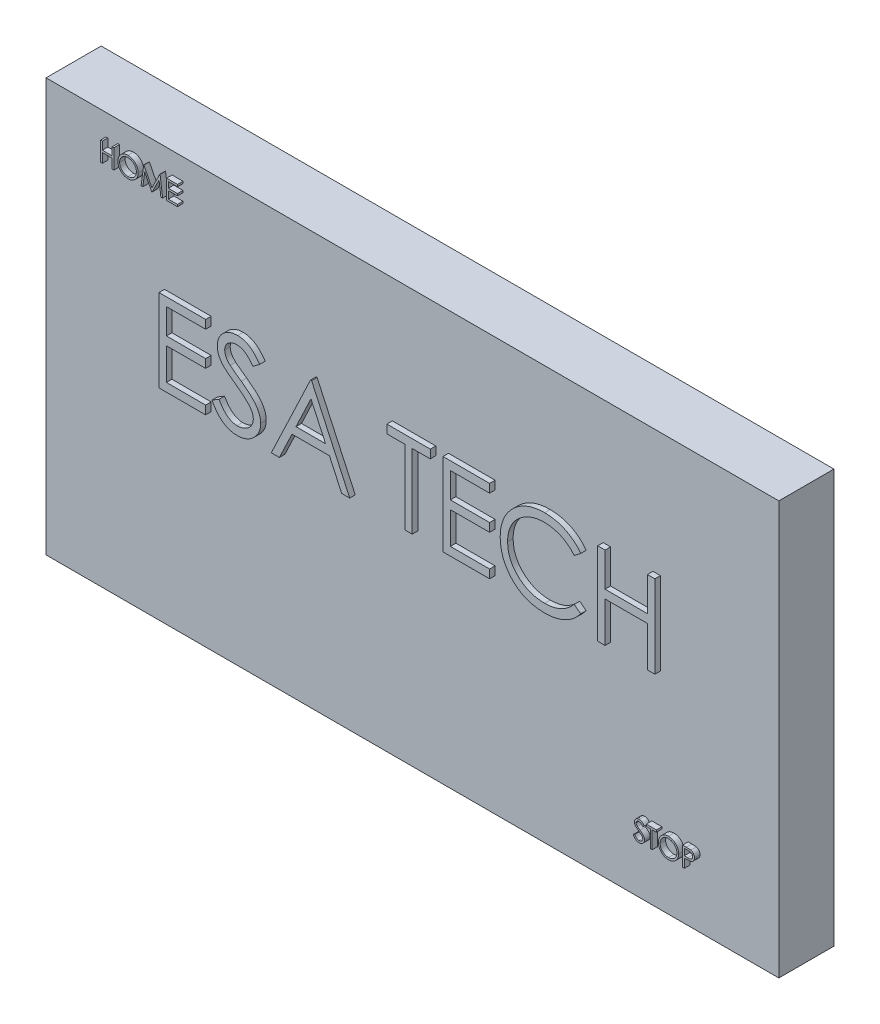
from build123d import *

# Parameters (mm, degrees)
SKETCH1_W            = 133
SKETCH1_H            = 75
BOSS_EXTRUDE1_DEPTH  = 10
BOSS_EXTRUDE2_START  = 2.999985
BOSS_EXTRUDE2_DEPTH  = 1
BOSS_EXTRUDE3_START  = 2.999985
BOSS_EXTRUDE3_DEPTH  = 1
BOSS_EXTRUDE4_DEPTH  = 1
BOSS_EXTRUDE5_DEPTH  = 1
BOSS_EXTRUDE6_DEPTH  = 1
BOSS_EXTRUDE7_DEPTH  = 1
BOSS_EXTRUDE8_DEPTH  = 1
BOSS_EXTRUDE9_DEPTH  = 1
BOSS_EXTRUDE10_START = 2.999985
BOSS_EXTRUDE10_DEPTH = 1
BOSS_EXTRUDE11_DEPTH = 1
BOSS_EXTRUDE12_DEPTH = 1
BOSS_EXTRUDE13_START = 2.999985
BOSS_EXTRUDE13_DEPTH = 1
CUT_EXTRUDE1_START   = 2.999999
CUT_EXTRUDE1_DEPTH   = 1
BOSS_EXTRUDE14_START = 2.999985
BOSS_EXTRUDE14_DEPTH = 1
CUT_EXTRUDE2_START   = 2.999999
CUT_EXTRUDE2_DEPTH   = 1
BOSS_EXTRUDE15_START = 2.999985
BOSS_EXTRUDE15_DEPTH = 1
CUT_EXTRUDE3_START   = 2.999999
CUT_EXTRUDE3_DEPTH   = 1
BOSS_EXTRUDE16_DEPTH = 1
CUT_EXTRUDE4_DEPTH   = 1
CHAMFER1_SIZE        = 0.227425604
CHAMFER1_SIZE2       = 0.226309079
CHAMFER2_SIZE        = 0.078921873
CHAMFER2_SIZE2       = 0.078895622


with BuildPart() as part:
    # Sketch1 → Boss-Extrude1 (new body)
    with BuildSketch(Plane.XY.offset(10)):
        Rectangle(SKETCH1_W, SKETCH1_H)
    extrude(amount=-BOSS_EXTRUDE1_DEPTH)

    # Sketch2 → Boss-Extrude2 (add)
    with BuildSketch(Plane.YX.offset(-12.999984601).offset(BOSS_EXTRUDE2_START)):
        with BuildLine():
            Line((11.923076923, -27.947716346), (12.845552885, -26.730769231))
            add(Edge.make_bspline(
                [(12.845552885, -26.730769231), (12.934592021, -26.795726223), (13.112528384, -26.92553668), (13.37334557, -27.128099381), (13.626750116, -27.339400509), (13.874197113, -27.558038308), (14.112879629, -27.786834519), (14.339712785, -28.027370182), (14.551104537, -28.280292035), (14.743619033, -28.546727288), (14.910723577, -28.829990449), (15.054967765, -29.126821001), (15.175975464, -29.434259553), (15.271602149, -29.749422669), (15.339667891, -30.070649943), (15.373191473, -30.39781079), (15.380798305, -30.617116627), (15.384615385, -30.727163462)],
                knots=[0, 0, 0, 0, 0.066899412, 0.133692199, 0.20041399, 0.267146725, 0.334090836, 0.401040231, 0.467732967, 0.534050835, 0.600332711, 0.667097858, 0.734184949, 0.800672998, 0.866809535, 0.933165531, 1, 1, 1, 1], degree=3))
            add(Edge.make_bspline(
                [(15.384615385, -30.727163462), (15.379671748, -30.853360166), (15.369816819, -31.104927944), (15.325697899, -31.480211122), (15.237640586, -31.848211258), (15.113548183, -32.206498702), (14.958004352, -32.55302918), (14.76688459, -32.881074887), (14.546918523, -33.190532211), (14.292754867, -33.472457934), (14.004820389, -33.717992458), (13.695111389, -33.935534983), (13.360698971, -34.114473719), (13.007429094, -34.252672755), (12.641426888, -34.352774288), (12.264844215, -34.410330167), (12.010951969, -34.418828196), (11.884014423, -34.423076923)],
                knots=[0, 0, 0, 0, 0.06670756, 0.132978692, 0.199237337, 0.266166899, 0.333030156, 0.399559483, 0.466405225, 0.533283994, 0.599491814, 0.665897015, 0.732872393, 0.799317181, 0.865884427, 0.932946744, 1, 1, 1, 1], degree=3))
            add(Edge.make_bspline(
                [(11.884014423, -34.423076923), (11.820413271, -34.421802112), (11.693528189, -34.419258847), (11.503869831, -34.406283678), (11.316187248, -34.379844427), (11.130143857, -34.343939678), (10.945847428, -34.296773609), (10.764361972, -34.237262011), (10.584971094, -34.170190479), (10.409140466, -34.093945135), (10.237630372, -34.008476708), (10.071139492, -33.913674637), (9.910350052, -33.809621897), (9.753820227, -33.699329581), (9.65152952, -33.622945322), (9.600360577, -33.584735577)],
                knots=[0, 0, 0, 0, 0.076926359, 0.153469034, 0.229723705, 0.305984153, 0.382513953, 0.459602945, 0.536846677, 0.614054811, 0.691256198, 0.768475609, 0.845617842, 0.922773318, 1, 1, 1, 1], degree=3))
            add(Edge.make_bspline(
                [(9.600360577, -33.584735577), (9.526164615, -33.521945685), (9.378016662, -33.396572365), (9.174125567, -33.188574777), (8.981588811, -32.970680601), (8.793074121, -32.748978655), (8.608835604, -32.523543232), (8.428208888, -32.295174417), (8.249979331, -32.064948341), (8.073829646, -31.833130863), (7.899866148, -31.59967061), (7.729142319, -31.363837166), (7.616445875, -31.205815714), (7.560096154, -31.126802885)],
                knots=[0, 0, 0, 0, 0.091029903, 0.181760484, 0.272564902, 0.36346873, 0.454414054, 0.545344958, 0.636277432, 0.727212888, 0.81814168, 0.90906842, 1, 1, 1, 1], degree=3))
            add(Edge.make_bspline(
                [(7.560096154, -31.126802885), (7.495896058, -31.03769788), (7.367505695, -30.859501513), (7.173042022, -30.593595844), (6.974897579, -30.330412068), (6.770843203, -30.071723289), (6.562123886, -29.816749526), (6.350637198, -29.564021872), (6.130962922, -29.318360971), (5.904666696, -29.078979065), (5.672696406, -28.845328246), (5.427451936, -28.625433543), (5.254707412, -28.490162902), (5.168269231, -28.422475962)],
                knots=[0, 0, 0, 0, 0.090937858, 0.181861792, 0.272772184, 0.3637034, 0.454659678, 0.545612317, 0.636550659, 0.727488865, 0.818360929, 0.909111151, 1, 1, 1, 1], degree=3))
            add(Edge.make_bspline(
                [(5.168269231, -28.422475962), (5.119414802, -28.388912047), (5.021720726, -28.321794372), (4.872374882, -28.225467786), (4.717673366, -28.138896131), (4.557584193, -28.064140742), (4.393091731, -28.000331322), (4.22404899, -27.948082702), (4.050235642, -27.911579814), (3.873333102, -27.893622528), (3.755072894, -27.887618758), (3.695913462, -27.884615385)],
                knots=[0, 0, 0, 0, 0.111506806, 0.222979873, 0.334206595, 0.444719704, 0.555085696, 0.665888102, 0.777232529, 0.888561018, 1, 1, 1, 1], degree=3))
            add(Edge.make_bspline(
                [(3.695913462, -27.884615385), (3.619123461, -27.888110904), (3.465549545, -27.895101666), (3.237181951, -27.925101607), (3.015060659, -27.981963886), (2.801632103, -28.062698454), (2.595527415, -28.160469425), (2.398295358, -28.275612715), (2.213272453, -28.409156146), (2.043100459, -28.560929125), (1.887437665, -28.727545819), (1.746156288, -28.906274863), (1.621577249, -29.096304599), (1.512483774, -29.295411686), (1.416168574, -29.501415839), (1.333967026, -29.713382152), (1.267910413, -29.929921652), (1.216046752, -30.149191692), (1.178590788, -30.371413225), (1.160773593, -30.59677247), (1.156159798, -30.747655263), (1.153846154, -30.823317308)],
                knots=[0, 0, 0, 0, 0.053360113, 0.106715999, 0.159595908, 0.212161618, 0.264914702, 0.317817843, 0.37050748, 0.423067038, 0.47587592, 0.528635141, 0.581052916, 0.633442318, 0.686139213, 0.738839276, 0.791151662, 0.843192932, 0.895193035, 0.94744325, 1, 1, 1, 1], degree=3))
            add(Edge.make_bspline(
                [(1.153846154, -30.823317308), (1.158127915, -30.90914759), (1.166652088, -31.080019377), (1.196396648, -31.33431264), (1.25695991, -31.581967916), (1.340868405, -31.822777609), (1.445425942, -32.056654126), (1.569670824, -32.281096965), (1.711277463, -32.494491384), (1.867113783, -32.697427435), (2.035469273, -32.89058437), (2.21464271, -33.073610752), (2.40255819, -33.246467378), (2.597416165, -33.409986521), (2.798400013, -33.565202779), (3.005349319, -33.71248934), (3.217938439, -33.852154329), (3.434882664, -33.985757338), (3.580824506, -34.072956599), (3.653846154, -34.116586538)],
                knots=[0, 0, 0, 0, 0.059418207, 0.118290362, 0.17669964, 0.23529837, 0.294403489, 0.353612753, 0.412464766, 0.471314735, 0.530401809, 0.589520184, 0.648316092, 0.706869356, 0.765349268, 0.823851086, 0.882453188, 0.941185737, 1, 1, 1, 1], degree=3))
            Line((3.653846154, -34.116586538), (2.893629808, -35.384615385))
            add(Edge.make_bspline(
                [(2.893629808, -35.384615385), (2.811002445, -35.338863079), (2.64588711, -35.247435652), (2.400721958, -35.106395738), (2.160300001, -34.958399678), (1.924437518, -34.804062932), (1.693948291, -34.64211652), (1.469655853, -34.471485994), (1.251343897, -34.292293324), (1.040958563, -34.102168919), (0.839323489, -33.901602975), (0.648493372, -33.691104517), (0.471592098, -33.470278673), (0.311909376, -33.238030445), (0.167049619, -32.996034724), (0.036534861, -32.744536024), (-0.077355182, -32.483858897), (-0.172896678, -32.216149591), (-0.253569606, -31.944761504), (-0.312442237, -31.668739586), (-0.353236644, -31.389637648), (-0.379407314, -31.107523464), (-0.382875046, -30.91828819), (-0.384615385, -30.823317308)],
                knots=[0, 0, 0, 0, 0.047706655, 0.09533283, 0.142849552, 0.190288718, 0.237687932, 0.285103529, 0.332606327, 0.380306098, 0.428277812, 0.476201887, 0.523747075, 0.571081125, 0.618449464, 0.666123707, 0.714107882, 0.762015202, 0.809618766, 0.857011561, 0.90442753, 0.95203536, 1, 1, 1, 1], degree=3))
            add(Edge.make_bspline(
                [(-0.384615385, -30.823317308), (-0.382788371, -30.73538652), (-0.379137066, -30.559656013), (-0.361611732, -30.296359677), (-0.324882235, -30.035104343), (-0.272966418, -29.777077882), (-0.206010278, -29.523586034), (-0.123988074, -29.275593527), (-0.026735125, -29.033161149), (0.086133342, -28.79673205), (0.214701141, -28.567289035), (0.3586448, -28.346917171), (0.515944872, -28.136351431), (0.684830432, -27.935589961), (0.86381476, -27.743291975), (1.053805137, -27.56108972), (1.253896196, -27.390078738), (1.463431456, -27.232041946), (1.680984734, -27.086359672), (1.909406425, -26.957655611), (2.147552622, -26.846078587), (2.3914925, -26.747670341), (2.641754368, -26.669599903), (2.895715292, -26.6114771), (3.152154141, -26.566238498), (3.412687446, -26.543706864), (3.587264623, -26.540214336), (3.674879808, -26.538461538)],
                knots=[0, 0, 0, 0, 0.040239435, 0.08041889, 0.120650262, 0.160854907, 0.200779484, 0.240536377, 0.280292178, 0.320215864, 0.36032453, 0.400539163, 0.440561078, 0.480507951, 0.520520085, 0.560703885, 0.600884534, 0.640878093, 0.680723081, 0.720595254, 0.760706186, 0.800977852, 0.840861452, 0.880503497, 0.92011634, 0.959908725, 1, 1, 1, 1], degree=3))
            add(Edge.make_bspline(
                [(3.674879808, -26.538461538), (3.814363241, -26.545249487), (4.093368773, -26.558827266), (4.506276267, -26.629894027), (4.904379231, -26.752881475), (5.287820376, -26.912483857), (5.655124041, -27.107290767), (6.005786215, -27.33078104), (6.337360808, -27.580381159), (6.647164883, -27.854846688), (6.94322475, -28.144181419), (7.227201617, -28.446412852), (7.501137878, -28.758242542), (7.766445999, -29.077529154), (8.021907203, -29.404652738), (8.27096842, -29.736705347), (8.434062615, -29.960298066), (8.515625, -30.072115385)],
                knots=[0, 0, 0, 0, 0.067213014, 0.13444466, 0.201107691, 0.267468052, 0.33418469, 0.401072722, 0.467531967, 0.533823869, 0.600253398, 0.666832855, 0.73348877, 0.800114117, 0.866721207, 0.93334811, 1, 1, 1, 1], degree=3))
            ThreePointArc((8.515625, -30.072115385), (9.24194464, -31.095319886), (10.009014423, -32.088341346))
            add(Edge.make_bspline(
                [(10.009014423, -32.088341346), (10.067466114, -32.147662854), (10.184355316, -32.266291479), (10.366247974, -32.437486424), (10.558686048, -32.595473752), (10.761943524, -32.737474427), (10.977664021, -32.85926949), (11.207506081, -32.956472557), (11.449227808, -33.020970224), (11.695860423, -33.0710973), (11.863216202, -33.074977731), (11.947115385, -33.076923077)],
                knots=[0, 0, 0, 0, 0.111360668, 0.222694322, 0.333842922, 0.444006591, 0.553828019, 0.664574574, 0.776591027, 0.888000103, 1, 1, 1, 1], degree=3))
            add(Edge.make_bspline(
                [(11.947115385, -33.076923077), (12.0188071, -33.072825307), (12.161607055, -33.064663119), (12.374380212, -33.034524232), (12.581068609, -32.972549532), (12.778153897, -32.883544809), (12.962645491, -32.770024311), (13.131219956, -32.634302145), (13.283691367, -32.480341365), (13.42107534, -32.312253384), (13.541015374, -32.130889753), (13.639928847, -31.937369445), (13.719190824, -31.735225572), (13.780258205, -31.526969312), (13.820731729, -31.313074337), (13.838811017, -31.09557189), (13.843706154, -30.950128973), (13.846153846, -30.877403846)],
                knots=[0, 0, 0, 0, 0.066366161, 0.132192189, 0.198088556, 0.265068441, 0.331532604, 0.397750822, 0.464609036, 0.531454744, 0.598098564, 0.665179918, 0.731933913, 0.798504812, 0.865495221, 0.932744218, 1, 1, 1, 1], degree=3))
            add(Edge.make_bspline(
                [(13.846153846, -30.877403846), (13.842515888, -30.782897127), (13.835248259, -30.594098985), (13.796726291, -30.313862618), (13.725400785, -30.041644733), (13.626082648, -29.779072873), (13.498285442, -29.528682011), (13.346097931, -29.292343268), (13.171182873, -29.073099866), (12.980342322, -28.868384286), (12.782107424, -28.670381036), (12.575715938, -28.480174032), (12.361990669, -28.298053288), (12.144379395, -28.120581531), (11.996852438, -28.005344342), (11.923076923, -27.947716346)],
                knots=[0, 0, 0, 0, 0.077693698, 0.155210401, 0.23189825, 0.308458723, 0.385459809, 0.462477269, 0.539060596, 0.615599465, 0.692360025, 0.769263856, 0.846170614, 0.923072757, 1, 1, 1, 1], degree=3))
        make_face()
    extrude(amount=-BOSS_EXTRUDE2_DEPTH)

    # Sketch3 → Boss-Extrude3 (add)
    with BuildSketch(Plane.YX.offset(-12.999984601).offset(BOSS_EXTRUDE3_START)):
        with BuildLine():
            Line((-25.053737131, 42.793576446), (-24.83849274, 43.077530773))
            add(Edge.make_bspline(
                [(-24.83849274, 43.077530773), (-24.812670171, 43.058477977), (-24.76104004, 43.020383457), (-24.685695671, 42.960451675), (-24.612704164, 42.89780347), (-24.543035081, 42.831870683), (-24.477918231, 42.761992387), (-24.418291552, 42.687561593), (-24.366306648, 42.606964371), (-24.323187661, 42.520830537), (-24.288805708, 42.430782139), (-24.263243664, 42.337931355), (-24.249328938, 42.242140857), (-24.24714394, 42.177536576), (-24.246044824, 42.145038786)],
                knots=[0, 0, 0, 0, 0.083486216, 0.16692391, 0.250412487, 0.333679126, 0.416350769, 0.498736837, 0.581476995, 0.665381251, 0.748876072, 0.831897824, 0.915439827, 1, 1, 1, 1], degree=3))
            add(Edge.make_bspline(
                [(-24.246044824, 42.145038786), (-24.247197527, 42.115515291), (-24.249502108, 42.05648949), (-24.259932259, 41.968382552), (-24.280714097, 41.882296797), (-24.309676795, 41.798819191), (-24.346120503, 41.718386109), (-24.390142985, 41.641779991), (-24.441735147, 41.570012367), (-24.501055877, 41.504174073), (-24.568412023, 41.446780367), (-24.640788061, 41.396137721), (-24.7187656, 41.354428083), (-24.801294658, 41.322282097), (-24.886747459, 41.298791407), (-24.974466627, 41.286119125), (-25.033325074, 41.283814903), (-25.062851715, 41.282658978)],
                knots=[0, 0, 0, 0, 0.066883105, 0.133718204, 0.200473988, 0.266953758, 0.333496678, 0.400102406, 0.466655573, 0.533260572, 0.600199319, 0.666562441, 0.732911379, 0.799876238, 0.866693671, 0.933126198, 1, 1, 1, 1], degree=3))
            add(Edge.make_bspline(
                [(-25.062851715, 41.282658978), (-25.084358157, 41.283316382), (-25.127350754, 41.284630568), (-25.191574524, 41.29149697), (-25.254644185, 41.304552751), (-25.31611078, 41.322871306), (-25.375982103, 41.34533957), (-25.434194221, 41.372205132), (-25.490310988, 41.403749093), (-25.543928802, 41.439713135), (-25.578443793, 41.465417533), (-25.595704279, 41.478271959)],
                knots=[0, 0, 0, 0, 0.11151871, 0.22293222, 0.334332187, 0.444896009, 0.555107746, 0.665571551, 0.776922488, 0.888441916, 1, 1, 1, 1], degree=3))
            add(Edge.make_bspline(
                [(-25.595704279, 41.478271959), (-25.632537973, 41.511867778), (-25.70614559, 41.5790049), (-25.801963025, 41.693919767), (-25.894532711, 41.81104957), (-25.984543561, 41.930410286), (-26.042691511, 42.011329364), (-26.071765977, 42.051789587)],
                knots=[0, 0, 0, 0, 0.200006492, 0.39968843, 0.599775239, 0.799884235, 1, 1, 1, 1], degree=3))
            add(Edge.make_bspline(
                [(-26.071765977, 42.051789587), (-26.095411392, 42.084386547), (-26.142695946, 42.149571816), (-26.215537791, 42.245940243), (-26.29046074, 42.340702007), (-26.368019054, 42.433368251), (-26.449961367, 42.522095471), (-26.535815342, 42.607139242), (-26.598517071, 42.657584048), (-26.629858926, 42.682799203)],
                knots=[0, 0, 0, 0, 0.142925154, 0.285812378, 0.428709521, 0.571660387, 0.714554935, 0.857318483, 1, 1, 1, 1], degree=3))
            add(Edge.make_bspline(
                [(-26.629858926, 42.682799203), (-26.64457332, 42.692771748), (-26.673977405, 42.712700098), (-26.719533175, 42.740175121), (-26.766779828, 42.764337666), (-26.816165368, 42.783502644), (-26.867262055, 42.798160512), (-26.92010551, 42.805661095), (-26.955641016, 42.807420373), (-26.973408606, 42.808300004)],
                knots=[0, 0, 0, 0, 0.143344503, 0.286448369, 0.42881728, 0.570733771, 0.713090168, 0.856546403, 1, 1, 1, 1], degree=3))
            add(Edge.make_bspline(
                [(-26.973408606, 42.808300004), (-26.99964375, 42.806936936), (-27.051863535, 42.804223816), (-27.128684255, 42.788015977), (-27.201081803, 42.759080865), (-27.269607437, 42.722251831), (-27.332135168, 42.675727543), (-27.387963891, 42.621417261), (-27.436176094, 42.560293484), (-27.476629491, 42.493939749), (-27.509475188, 42.423715753), (-27.534962005, 42.350804607), (-27.553594312, 42.276093915), (-27.56427809, 42.199734703), (-27.56579566, 42.148385638), (-27.566557644, 42.122602889)],
                knots=[0, 0, 0, 0, 0.078130191, 0.155514367, 0.232376596, 0.309483167, 0.386489028, 0.463562058, 0.540690236, 0.617592712, 0.694390532, 0.771030645, 0.847161898, 0.923258845, 1, 1, 1, 1], degree=3))
            add(Edge.make_bspline(
                [(-27.566557644, 42.122602889), (-27.565209514, 42.094474739), (-27.562522837, 42.038418395), (-27.546500417, 41.955278565), (-27.518179432, 41.875567741), (-27.480513094, 41.799729801), (-27.434373625, 41.728712315), (-27.381693296, 41.662542842), (-27.323612828, 41.601234413), (-27.261354704, 41.544642221), (-27.195797224, 41.491993892), (-27.127037442, 41.443217225), (-27.055805532, 41.397721546), (-27.007421943, 41.368691785), (-26.983224311, 41.354173402)],
                knots=[0, 0, 0, 0, 0.083395044, 0.166197256, 0.249846011, 0.333369245, 0.416607875, 0.500373624, 0.583714809, 0.666633625, 0.74955454, 0.832769738, 0.916364694, 1, 1, 1, 1], degree=3))
            Line((-26.983224311, 41.354173402), (-27.160608125, 41.058300004))
            add(Edge.make_bspline(
                [(-27.160608125, 41.058300004), (-27.205592636, 41.083563363), (-27.295392106, 41.133994861), (-27.424895483, 41.21803715), (-27.546471696, 41.31285498), (-27.658035256, 41.419366023), (-27.754579421, 41.539726684), (-27.83085373, 41.673970607), (-27.885856682, 41.817865856), (-27.918130728, 41.968968991), (-27.923061937, 42.071329849), (-27.925532003, 42.122602889)],
                knots=[0, 0, 0, 0, 0.111739934, 0.223058707, 0.334050715, 0.445241569, 0.556449804, 0.667006894, 0.778285359, 0.888942084, 1, 1, 1, 1], degree=3))
            add(Edge.make_bspline(
                [(-27.925532003, 42.122602889), (-27.924364577, 42.161981124), (-27.922030193, 42.240721809), (-27.903317502, 42.35745849), (-27.871232384, 42.470697658), (-27.82568555, 42.579101687), (-27.766562066, 42.680851974), (-27.69609359, 42.775360644), (-27.615765809, 42.861752223), (-27.526671266, 42.939007331), (-27.428976451, 43.005225249), (-27.323148992, 43.057706687), (-27.211567399, 43.095642831), (-27.095699626, 43.117867296), (-27.017509659, 43.120888281), (-26.978316458, 43.122402568)],
                knots=[0, 0, 0, 0, 0.077240033, 0.154449102, 0.231266412, 0.307692994, 0.384533455, 0.461594798, 0.538546189, 0.615562988, 0.692509964, 0.769485815, 0.846626127, 0.923120404, 1, 1, 1, 1], degree=3))
            add(Edge.make_bspline(
                [(-26.978316458, 43.122402568), (-26.924018141, 43.119159111), (-26.815669894, 43.112687032), (-26.660070315, 43.063045247), (-26.514630759, 42.991848184), (-26.380742557, 42.901004911), (-26.260217883, 42.793828636), (-26.148413059, 42.678101459), (-26.04378195, 42.555485703), (-25.944345038, 42.428244179), (-25.880656406, 42.341339538), (-25.848809247, 42.297883337)],
                knots=[0, 0, 0, 0, 0.111918459, 0.223324949, 0.334248749, 0.445556029, 0.556141994, 0.666668487, 0.77756234, 0.888771237, 1, 1, 1, 1], degree=3))
            ThreePointArc((-25.848809247, 42.297883337), (-25.679334803, 42.059135517), (-25.500351715, 41.827430613))
            add(Edge.make_bspline(
                [(-25.500351715, 41.827430613), (-25.475528197, 41.802612809), (-25.426034064, 41.753130068), (-25.344678577, 41.686733949), (-25.253312244, 41.63527884), (-25.152678183, 41.604081894), (-25.083066514, 41.599207846), (-25.048128157, 41.596761543)],
                knots=[0, 0, 0, 0, 0.201379573, 0.40151874, 0.60055954, 0.799519339, 1, 1, 1, 1], degree=3))
            add(Edge.make_bspline(
                [(-25.048128157, 41.596761543), (-25.024963655, 41.598037957), (-24.978925856, 41.60057474), (-24.911080046, 41.616036105), (-24.847796664, 41.644302487), (-24.790431419, 41.683100492), (-24.740206359, 41.73055444), (-24.696745107, 41.784299616), (-24.66157956, 41.843867718), (-24.634657039, 41.907296491), (-24.616718497, 41.973580986), (-24.607942537, 42.041548274), (-24.60599586, 42.0871191), (-24.605019183, 42.109982696)],
                knots=[0, 0, 0, 0, 0.091853764, 0.182552814, 0.273998291, 0.364976085, 0.455735916, 0.546908223, 0.638052234, 0.728992824, 0.819241521, 0.909310645, 1, 1, 1, 1], degree=3))
            add(Edge.make_bspline(
                [(-24.605019183, 42.109982696), (-24.606016699, 42.135876227), (-24.60800199, 42.18741039), (-24.621112486, 42.263823972), (-24.644100948, 42.337796154), (-24.676545084, 42.408350608), (-24.717282892, 42.474412422), (-24.765616799, 42.534955543), (-24.818352521, 42.591648926), (-24.874450745, 42.645233501), (-24.932773638, 42.696423529), (-24.992626476, 42.745777919), (-25.033362471, 42.77764013), (-25.053737131, 42.793576446)],
                knots=[0, 0, 0, 0, 0.091193737, 0.181496795, 0.272125626, 0.363260606, 0.454284385, 0.544760946, 0.635644428, 0.726818149, 0.817861369, 0.908900897, 1, 1, 1, 1], degree=3))
        make_face()
    extrude(amount=-BOSS_EXTRUDE3_DEPTH)

    # Sketch4 → Boss-Extrude4 (add)
    with BuildSketch(Plane.XY.offset(10)):
        Polygon((-55.606872892, 30.161136831), (-55.606872892, 33.661136831), (-55.292770328, 33.661136831), (-55.292770328, 32.225239395), (-53.497898533, 32.225239395), (-53.497898533, 33.661136831), (-53.183795969, 33.661136831), (-53.183795969, 30.161136831), (-53.497898533, 30.161136831), (-53.497898533, 31.866265036), (-55.292770328, 31.866265036), (-55.292770328, 30.161136831), align=None)
    extrude(amount=BOSS_EXTRUDE4_DEPTH)

    # Sketch5 → Boss-Extrude5 (add)
    with BuildSketch(Plane.XY.offset(10)):
        Polygon((34.615384615, 0), (34.615384615, 15), (35.961538462, 15), (35.961538462, 8.846153846), (43.653846154, 8.846153846), (43.653846154, 15), (45, 15), (45, 0), (43.653846154, 0), (43.653846154, 7.307692308), (35.961538462, 7.307692308), (35.961538462, 0), align=None)
    extrude(amount=BOSS_EXTRUDE5_DEPTH)

    # Sketch6 → Boss-Extrude6 (add)
    with BuildSketch(Plane.XY.offset(10)):
        Polygon((6.538461538, 0), (6.538461538, 15), (15, 15), (15, 13.461538462), (7.884615385, 13.461538462), (7.884615385, 8.846153846), (15, 8.846153846), (15, 7.307692308), (7.884615385, 7.307692308), (7.884615385, 1.538461538), (15, 1.538461538), (15, 0), align=None)
    extrude(amount=BOSS_EXTRUDE6_DEPTH)

    # Sketch7 → Boss-Extrude7 (add)
    with BuildSketch(Plane.XY.offset(10)):
        Polygon((-45, 0), (-45, 15), (-36.538461538, 15), (-36.538461538, 13.461538462), (-43.653846154, 13.461538462), (-43.653846154, 8.846153846), (-36.538461538, 8.846153846), (-36.538461538, 7.307692308), (-43.653846154, 7.307692308), (-43.653846154, 1.538461538), (-36.538461538, 1.538461538), (-36.538461538, 0), align=None)
    extrude(amount=BOSS_EXTRUDE7_DEPTH)

    # Sketch8 → Boss-Extrude8 (add)
    with BuildSketch(Plane.XY.offset(10)):
        Polygon((-47.931692603, 30.161136831), (-48.247898533, 30.161136831), (-47.78585927, 33.661136831), (-47.740987475, 33.661136831), (-46.295975456, 30.789341959), (-44.854469045, 33.661136831), (-44.808896129, 33.661136831), (-44.344052379, 30.161136831), (-44.659557186, 30.161136831), (-44.994693404, 32.679566318), (-46.293492277, 30.090617622), (-47.597257507, 32.685175293), align=None)
    extrude(amount=BOSS_EXTRUDE8_DEPTH)

    # Sketch9 → Boss-Extrude9 (add)
    with BuildSketch(Plane.XY.offset(10)):
        Polygon((-43.626103661, 30.161136831), (-43.626103661, 33.661136831), (-41.651744686, 33.661136831), (-41.651744686, 33.302162472), (-43.312001097, 33.302162472), (-43.312001097, 32.225239395), (-41.651744686, 32.225239395), (-41.651744686, 31.866265036), (-43.312001097, 31.866265036), (-43.312001097, 30.52011119), (-41.651744686, 30.52011119), (-41.651744686, 30.161136831), align=None)
    extrude(amount=BOSS_EXTRUDE9_DEPTH)

    # Sketch10 → Boss-Extrude10 (add)
    with BuildSketch(Plane.YX.offset(-12.999984601).offset(BOSS_EXTRUDE10_START)):
        with BuildLine():
            Line((2.761418269, 31.538461538), (3.653846154, 30.360576923))
            add(Edge.make_bspline(
                [(3.653846154, 30.360576923), (3.565084819, 30.279702981), (3.387742737, 30.118119637), (3.127737832, 29.869751829), (2.880832, 29.608940106), (2.648182572, 29.335165735), (2.429260937, 29.049271132), (2.224910199, 28.752183928), (2.036474119, 28.445300044), (1.865177534, 28.129747388), (1.712201467, 27.805555546), (1.577877334, 27.472690091), (1.461901006, 27.131804015), (1.364460095, 26.784557715), (1.285165082, 26.433162995), (1.224122869, 26.079029731), (1.183638388, 25.722118457), (1.16383843, 25.363006118), (1.157179669, 25.123104564), (1.153846154, 25.003004808)],
                knots=[0, 0, 0, 0, 0.058939316, 0.117758718, 0.176444357, 0.235131373, 0.294022955, 0.353111625, 0.412039208, 0.470700737, 0.529256185, 0.58789227, 0.646789437, 0.705903509, 0.764832009, 0.823527472, 0.882202473, 0.941028084, 1, 1, 1, 1], degree=3))
            add(Edge.make_bspline(
                [(1.153846154, 25.003004808), (1.158069392, 24.77296998), (1.166486773, 24.314485064), (1.254556906, 23.632055877), (1.397910688, 22.958910778), (1.608761411, 22.301818376), (1.890452331, 21.671870079), (2.236561959, 21.074914264), (2.649425795, 20.521386906), (3.114203477, 20.010560636), (3.630389939, 19.55195889), (4.192405716, 19.15020342), (4.799770875, 18.822869804), (5.439026198, 18.565779082), (6.106816107, 18.393807108), (6.791468671, 18.28689635), (7.253843972, 18.275118351), (7.484975962, 18.269230769)],
                knots=[0, 0, 0, 0, 0.066750241, 0.133040631, 0.199383062, 0.266332594, 0.332971518, 0.39934348, 0.466238425, 0.533059937, 0.59950377, 0.6663326, 0.733147023, 0.799339077, 0.86584394, 0.93293812, 1, 1, 1, 1], degree=3))
            add(Edge.make_bspline(
                [(7.484975962, 18.269230769), (7.589339687, 18.270697941), (7.797698415, 18.2736271), (8.109459955, 18.292177475), (8.418990747, 18.328792894), (8.727000339, 18.37739445), (9.032907259, 18.441505042), (9.335401603, 18.521022192), (9.632570615, 18.616329407), (9.922539296, 18.728017022), (10.206668591, 18.851467561), (10.483851517, 18.989974748), (10.752495743, 19.145920702), (11.014231986, 19.315355642), (11.268464353, 19.496398582), (11.512466109, 19.689621709), (11.743877127, 19.895315403), (11.962955325, 20.112597632), (12.171115806, 20.340135713), (12.368532405, 20.57792227), (12.555189807, 20.825905042), (12.730888, 21.083082476), (12.894695772, 21.348205132), (13.04508643, 21.620363585), (13.182879496, 21.898235589), (13.311528178, 22.180336732), (13.425729661, 22.46931231), (13.524666668, 22.764771991), (13.611378617, 23.064443415), (13.685717545, 23.366997825), (13.744844976, 23.672053056), (13.789846454, 23.978962526), (13.824400331, 24.287452141), (13.841928308, 24.598154116), (13.844743568, 24.805824959), (13.846153846, 24.909855769)],
                knots=[0, 0, 0, 0, 0.030521127, 0.060934421, 0.091280412, 0.121635089, 0.152096376, 0.182641045, 0.213062685, 0.243308945, 0.273474427, 0.303627947, 0.333867404, 0.364263957, 0.39477917, 0.425105694, 0.455237525, 0.485272985, 0.515299701, 0.545388397, 0.575617742, 0.606033776, 0.636441163, 0.66672057, 0.696930182, 0.727124989, 0.757366416, 0.787749839, 0.818209926, 0.848574486, 0.878828452, 0.909040917, 0.939266705, 0.969576211, 1, 1, 1, 1], degree=3))
            add(Edge.make_bspline(
                [(13.846153846, 24.909855769), (13.840644429, 25.140695794), (13.82963156, 25.602125946), (13.74056985, 26.28984637), (13.588146262, 26.963817187), (13.371569322, 27.618387577), (13.089295269, 28.247607388), (12.742290222, 28.844525744), (12.335755381, 29.402413596), (11.869031514, 29.911050522), (11.520842729, 30.210394061), (11.346153846, 30.360576923)],
                knots=[0, 0, 0, 0, 0.111548768, 0.222976778, 0.334512224, 0.445081137, 0.555664748, 0.667244173, 0.778199289, 0.888720946, 1, 1, 1, 1], degree=3))
            Line((11.346153846, 30.360576923), (12.247596154, 31.538461538))
            add(Edge.make_bspline(
                [(12.247596154, 31.538461538), (12.335122488, 31.47215913), (12.509734017, 31.339888481), (12.763868745, 31.13286332), (13.005598022, 30.913644763), (13.23431938, 30.682469855), (13.454858527, 30.443921788), (13.664230101, 30.194902933), (13.861888504, 29.935200972), (14.04890898, 29.665811367), (14.224972559, 29.38780116), (14.389308621, 29.10250564), (14.541054153, 28.8113742), (14.679959968, 28.515026919), (14.805680572, 28.213508753), (14.919413352, 27.907239989), (15.022093539, 27.596291445), (15.10985084, 27.279605605), (15.184594669, 26.958538308), (15.247417887, 26.634588042), (15.299188555, 26.308920374), (15.339083456, 25.981967638), (15.367124335, 25.653712233), (15.380778823, 25.324140503), (15.383335671, 25.104114427), (15.384615385, 24.993990385)],
                knots=[0, 0, 0, 0, 0.043674146, 0.087128172, 0.130334245, 0.173402748, 0.216440667, 0.259525713, 0.302755608, 0.346210012, 0.389929722, 0.433608542, 0.477130596, 0.520478172, 0.563750115, 0.607031511, 0.650401093, 0.693961041, 0.737695165, 0.781491694, 0.825189508, 0.868832502, 0.912478164, 0.956194926, 1, 1, 1, 1], degree=3))
            add(Edge.make_bspline(
                [(15.384615385, 24.993990385), (15.377820635, 24.715045983), (15.364275892, 24.158994505), (15.255913778, 23.331160072), (15.073186916, 22.5157585), (14.802138402, 21.724214222), (14.444358408, 20.970059316), (14.012256686, 20.258291154), (13.497428223, 19.600643671), (12.920697485, 18.994355988), (12.285552743, 18.448238145), (11.595112473, 17.972761955), (10.853133617, 17.582848627), (10.072119392, 17.280005065), (9.261335697, 17.070654928), (8.429626284, 16.944458543), (7.868092111, 16.93020727), (7.587139423, 16.923076923)],
                knots=[0, 0, 0, 0, 0.066757839, 0.133075963, 0.199481654, 0.266502597, 0.332902368, 0.398939301, 0.465410183, 0.532433962, 0.598956153, 0.665576696, 0.73267684, 0.799148112, 0.86563951, 0.932775345, 1, 1, 1, 1], degree=3))
            add(Edge.make_bspline(
                [(7.587139423, 16.923076923), (7.371535188, 16.92743215), (6.940466336, 16.936139783), (6.29662114, 17.00196102), (5.661505511, 17.114225879), (5.038592779, 17.272476865), (4.432660827, 17.482384967), (3.844744756, 17.744026503), (3.279589577, 18.056641666), (2.740255709, 18.416075036), (2.405886438, 18.688706539), (2.238581731, 18.825120192)],
                knots=[0, 0, 0, 0, 0.11147088, 0.222869575, 0.334238668, 0.44470338, 0.554834186, 0.665413503, 0.777020273, 0.888430064, 1, 1, 1, 1], degree=3))
            add(Edge.make_bspline(
                [(2.238581731, 18.825120192), (2.155434388, 18.89838832), (1.98955568, 19.044558023), (1.752548514, 19.275780789), (1.528266071, 19.517795651), (1.313615735, 19.767813601), (1.110769024, 20.028080091), (0.920884497, 20.299183772), (0.742308414, 20.578909041), (0.57599092, 20.865994152), (0.424248901, 21.15984527), (0.287375578, 21.459505407), (0.164094689, 21.764281846), (0.055233852, 22.074461627), (-0.042234868, 22.389019537), (-0.127693522, 22.70829861), (-0.197654246, 23.032454652), (-0.257015997, 23.359186017), (-0.304281554, 23.687763451), (-0.340225402, 24.017421946), (-0.368030617, 24.347904178), (-0.382550937, 24.679664296), (-0.383926743, 24.901155029), (-0.384615385, 25.012019231)],
                knots=[0, 0, 0, 0, 0.047859739, 0.095480042, 0.142932446, 0.190329672, 0.237762161, 0.285388139, 0.333231768, 0.381056675, 0.428635756, 0.476011595, 0.523294477, 0.570580695, 0.617947132, 0.66549856, 0.713280897, 0.761132719, 0.808901088, 0.856620669, 0.904340389, 0.952118871, 1, 1, 1, 1], degree=3))
            add(Edge.make_bspline(
                [(-0.384615385, 25.012019231), (-0.378122722, 25.292194955), (-0.365144577, 25.852236552), (-0.2534174, 26.686543431), (-0.059546525, 27.502465854), (0.214506578, 28.293820623), (0.576256099, 29.049073681), (1.012670282, 29.763214806), (1.529095907, 30.418924817), (2.107196603, 31.020346848), (2.542688318, 31.365237069), (2.761418269, 31.538461538)],
                knots=[0, 0, 0, 0, 0.111697532, 0.223271535, 0.334921125, 0.445651876, 0.556564489, 0.668254312, 0.778683181, 0.888841474, 1, 1, 1, 1], degree=3))
        make_face()
    extrude(amount=-BOSS_EXTRUDE10_DEPTH)

    # Sketch11 → Boss-Extrude11 (add)
    with BuildSketch(Plane.XY.offset(10)):
        Polygon((-0.384615385, 13.461538462), (-3.653846154, 13.461538462), (-3.653846154, 15), (4.230769231, 15), (4.230769231, 13.461538462), (0.961538462, 13.461538462), (0.961538462, 0), (-0.384615385, 0), align=None)
    extrude(amount=BOSS_EXTRUDE11_DEPTH)

    # Sketch12 → Boss-Extrude12 (add)
    with BuildSketch(Plane.XY.offset(10)):
        Polygon((44.199325645, -24.694762772), (43.436505132, -24.694762772), (43.436505132, -24.335788413), (45.276248722, -24.335788413), (45.276248722, -24.694762772), (44.513428209, -24.694762772), (44.513428209, -27.835788413), (44.199325645, -27.835788413), align=None)
    extrude(amount=BOSS_EXTRUDE12_DEPTH)

    # Sketch13 → Boss-Extrude13 (add)
    with BuildSketch(Plane.YX.offset(-12.999984601).offset(BOSS_EXTRUDE13_START)):
        with BuildLine():
            Line((-27.835788413, 50.032658978), (-27.835788413, 50.346761543))
            Line((-27.835788413, 50.346761543), (-26.220403798, 50.346761543))
            Line((-26.220403798, 50.346761543), (-26.220403798, 50.597062023))
            ThreePointArc((-26.220403798, 50.597062023), (-26.21380132, 51.044053538), (-26.162911811, 51.488187825))
            add(Edge.make_bspline(
                [(-26.162911811, 51.488187825), (-26.150188994, 51.532116654), (-26.124767112, 51.619892307), (-26.069597552, 51.746039397), (-25.995615041, 51.86210225), (-25.902986507, 51.963965968), (-25.795323288, 52.049452934), (-25.674294077, 52.114422293), (-25.544982414, 52.158689525), (-25.410475431, 52.181821696), (-25.319980253, 52.18494072), (-25.274590497, 52.186505132)],
                knots=[0, 0, 0, 0, 0.11150725, 0.222806342, 0.334641312, 0.445777686, 0.5572004, 0.668421111, 0.779235559, 0.889270959, 1, 1, 1, 1], degree=3))
            add(Edge.make_bspline(
                [(-25.274590497, 52.186505132), (-25.237826709, 52.185620288), (-25.164296666, 52.183850539), (-25.055172487, 52.167338604), (-24.948344691, 52.140359864), (-24.84640289, 52.098719731), (-24.751128736, 52.044013618), (-24.66458589, 51.976543699), (-24.5866041, 51.899631521), (-24.518477045, 51.814061503), (-24.46271756, 51.720484592), (-24.419363051, 51.620597193), (-24.398734504, 51.551127913), (-24.388372548, 51.516232696)],
                knots=[0, 0, 0, 0, 0.091604634, 0.183215418, 0.274495061, 0.365703422, 0.456831668, 0.547529553, 0.638507336, 0.729333545, 0.819444672, 0.909304985, 1, 1, 1, 1], degree=3))
            add(Edge.make_bspline(
                [(-24.388372548, 51.516232696), (-24.378241936, 51.46379543), (-24.357994092, 51.358990148), (-24.347468945, 51.199071278), (-24.340231291, 51.039267994), (-24.336466888, 50.879170772), (-24.336014575, 50.772429139), (-24.335788413, 50.719057216)],
                knots=[0, 0, 0, 0, 0.200017473, 0.399770799, 0.599835947, 0.799913825, 1, 1, 1, 1], degree=3))
            Line((-24.335788413, 50.719057216), (-24.335788413, 50.032658978))
            Line((-24.335788413, 50.032658978), (-27.835788413, 50.032658978))
        make_face()
    extrude(amount=-BOSS_EXTRUDE13_DEPTH)

    # Sketch14 → Cut-Extrude1 (cut)
    with BuildSketch(Plane.XY.offset(8.000001185).offset(CUT_EXTRUDE1_START)):
        with BuildLine():
            Line((50.959541991, -25.869141779), (50.346761543, -25.861429439))
            Line((50.346761543, -25.861429439), (50.346761543, -24.694762772))
            Line((50.346761543, -24.694762772), (50.986885741, -24.694762772))
            add(Edge.make_bspline(
                [(50.986885741, -24.694762772), (51.023268481, -24.695022786), (51.095946477, -24.69554219), (51.204818473, -24.700325971), (51.313505436, -24.710511496), (51.421583526, -24.727235574), (51.527328941, -24.756998614), (51.625356873, -24.807468761), (51.710157293, -24.87811375), (51.780094926, -24.963412314), (51.833321863, -25.060065578), (51.8660836, -25.165975569), (51.87029613, -25.239318335), (51.872402568, -25.27599274)],
                knots=[0, 0, 0, 0, 0.09067316, 0.181128294, 0.271500245, 0.362620241, 0.453422647, 0.544062739, 0.635182691, 0.726564896, 0.81743042, 0.908707686, 1, 1, 1, 1], degree=3))
            add(Edge.make_bspline(
                [(51.872402568, -25.27599274), (51.870741254, -25.307661563), (51.867423806, -25.370900459), (51.844743732, -25.463854269), (51.805447556, -25.550895797), (51.751966724, -25.630129464), (51.687019982, -25.700141782), (51.609679714, -25.756495455), (51.524435996, -25.799554555), (51.433234129, -25.828332422), (51.339568999, -25.846256772), (51.244959909, -25.857727038), (51.150003391, -25.864993087), (51.054833649, -25.868661701), (50.991321895, -25.868981672), (50.959541991, -25.869141779)],
                knots=[0, 0, 0, 0, 0.076796686, 0.153353908, 0.230465945, 0.307229193, 0.384292851, 0.460869498, 0.538051552, 0.614922556, 0.692001505, 0.769061223, 0.845964005, 0.922923728, 1, 1, 1, 1], degree=3))
        make_face()
    extrude(amount=-CUT_EXTRUDE1_DEPTH, mode=Mode.SUBTRACT)

    # Sketch15 → Boss-Extrude14 (add)
    with BuildSketch(Plane.YX.offset(-12.999984601).offset(BOSS_EXTRUDE14_START)):
        with BuildLine():
            add(Edge.make_bspline(
                [(-26.101213093, 45.635223081), (-26.165555145, 45.636879585), (-26.29378601, 45.640180924), (-26.484306769, 45.669310554), (-26.67111227, 45.716974848), (-26.851135677, 45.786396071), (-27.021997909, 45.875333734), (-27.182316376, 45.982086653), (-27.330390906, 46.105817411), (-27.465971268, 46.243377704), (-27.588005285, 46.393221846), (-27.69358639, 46.554974863), (-27.780467965, 46.727090998), (-27.846870374, 46.907708697), (-27.892534414, 47.094996996), (-27.920719522, 47.286724115), (-27.923928075, 47.415967843), (-27.925532003, 47.480575645)],
                knots=[0, 0, 0, 0, 0.066774158, 0.133077945, 0.19961318, 0.266609564, 0.332929059, 0.399236085, 0.466199537, 0.532927057, 0.599493558, 0.666523567, 0.733089602, 0.799258934, 0.865865268, 0.932947228, 1, 1, 1, 1], degree=3))
            add(Edge.make_bspline(
                [(-27.925532003, 47.480575645), (-27.923914761, 47.545056232), (-27.920691464, 47.673571401), (-27.892277687, 47.864617965), (-27.845212797, 48.051996339), (-27.777048931, 48.232889436), (-27.688684443, 48.404454964), (-27.581892495, 48.565037915), (-27.458737102, 48.713921528), (-27.321463062, 48.850206265), (-27.171932298, 48.973066781), (-27.010414329, 49.079547212), (-26.838385927, 49.167267269), (-26.657781085, 49.234494764), (-26.470467626, 49.281122835), (-26.278534419, 49.309822141), (-26.149092533, 49.313081132), (-26.08438617, 49.314710261)],
                knots=[0, 0, 0, 0, 0.066811336, 0.133160547, 0.199725922, 0.266757406, 0.333073018, 0.399351549, 0.466281275, 0.533023474, 0.599574556, 0.666575657, 0.733163625, 0.799320807, 0.865880862, 0.932955538, 1, 1, 1, 1], degree=3))
            add(Edge.make_bspline(
                [(-26.08438617, 49.314710261), (-26.026552953, 49.313342351), (-25.911062463, 49.310610693), (-25.739516852, 49.288695017), (-25.571362216, 49.252001654), (-25.407600039, 49.199206609), (-25.249911336, 49.129516879), (-25.099680533, 49.04483217), (-24.959130316, 48.945165546), (-24.828656893, 48.83266408), (-24.707769754, 48.709922949), (-24.598370703, 48.577338106), (-24.502291523, 48.435493761), (-24.420512646, 48.284601515), (-24.354758481, 48.125828851), (-24.304874325, 47.961702993), (-24.269379787, 47.794373089), (-24.251381945, 47.624041424), (-24.247828164, 47.509839158), (-24.246044824, 47.452530773)],
                knots=[0, 0, 0, 0, 0.059398273, 0.118615839, 0.177332326, 0.235994546, 0.295057837, 0.35414624, 0.412863092, 0.471759112, 0.530911839, 0.589642346, 0.648096747, 0.706639952, 0.765652887, 0.824322332, 0.882638748, 0.941106389, 1, 1, 1, 1], degree=3))
            add(Edge.make_bspline(
                [(-24.246044824, 47.452530773), (-24.246879835, 47.406278718), (-24.24854983, 47.313776219), (-24.264896267, 47.175970081), (-24.290119953, 47.040111565), (-24.326564709, 46.907382469), (-24.372994176, 46.77813851), (-24.429020155, 46.652364757), (-24.49456117, 46.53095737), (-24.568878889, 46.414930559), (-24.651956751, 46.3054792), (-24.74324298, 46.2027864), (-24.841872272, 46.106618828), (-24.948323572, 46.01901361), (-25.060720061, 45.939943829), (-25.178085181, 45.869152247), (-25.300364774, 45.806839192), (-25.4274425, 45.753765654), (-25.558206478, 45.710044019), (-25.691517821, 45.676124612), (-25.826707824, 45.652815194), (-25.963369715, 45.637497112), (-26.055146686, 45.635983048), (-26.101213093, 45.635223081)],
                knots=[0, 0, 0, 0, 0.048005392, 0.096009114, 0.143881529, 0.191369903, 0.238749944, 0.286347014, 0.334195874, 0.381869795, 0.429271574, 0.476716227, 0.524411524, 0.572155453, 0.61969964, 0.666978073, 0.71435203, 0.762068564, 0.809833746, 0.857393828, 0.904742455, 0.952186559, 1, 1, 1, 1], degree=3))
        make_face()
    extrude(amount=-BOSS_EXTRUDE14_DEPTH)

    # Sketch16 → Cut-Extrude2 (cut)
    with BuildSketch(Plane.XY.offset(8.000001185).offset(CUT_EXTRUDE2_START)):
        with BuildLine():
            add(Edge.make_bspline(
                [(45.949325645, -26.099810849), (45.95091157, -26.047097056), (45.954073775, -25.941990073), (45.976971947, -25.785437829), (46.0168678, -25.632512065), (46.073486011, -25.485104603), (46.146746155, -25.345867851), (46.23332635, -25.214349846), (46.335034511, -25.093422726), (46.449094759, -24.983489713), (46.574276203, -24.886441013), (46.708557894, -24.802543808), (46.850343329, -24.732325087), (46.99823372, -24.675675273), (47.151497817, -24.634393975), (47.308967945, -24.610526965), (47.414943837, -24.606855657), (47.467955453, -24.605019183)],
                knots=[0, 0, 0, 0, 0.066732015, 0.133058169, 0.199813816, 0.266465454, 0.332514112, 0.398649367, 0.465448707, 0.53214447, 0.59885819, 0.665623076, 0.732285748, 0.798881196, 0.865820644, 0.932880354, 1, 1, 1, 1], degree=3))
            add(Edge.make_bspline(
                [(47.467955453, -24.605019183), (47.52064702, -24.606819207), (47.625731128, -24.61040904), (47.782260701, -24.633117059), (47.935291491, -24.673019953), (48.083782728, -24.727608122), (48.226111144, -24.796293238), (48.361772943, -24.877461303), (48.48920278, -24.971354427), (48.60545049, -25.078963689), (48.708722438, -25.198702652), (48.798265529, -25.328891938), (48.872918784, -25.468020108), (48.93131386, -25.614962652), (48.972066681, -25.768017992), (48.995481813, -25.925143985), (48.99889817, -26.030810241), (49.000607696, -26.083685048)],
                knots=[0, 0, 0, 0, 0.066731064, 0.133083428, 0.199800698, 0.266661301, 0.333113846, 0.399638179, 0.466594632, 0.533190987, 0.599806065, 0.666427313, 0.732892152, 0.79934074, 0.866199435, 0.933046942, 1, 1, 1, 1], degree=3))
            add(Edge.make_bspline(
                [(49.000607696, -26.083685048), (48.998920591, -26.136593063), (48.995556323, -26.242097247), (48.972463137, -26.399213457), (48.93238661, -26.552808069), (48.87507482, -26.700803909), (48.801703152, -26.841113035), (48.714024327, -26.973113043), (48.611670317, -27.094598905), (48.495494659, -27.203249662), (48.368687513, -27.298936901), (48.232757383, -27.381119863), (48.089266909, -27.449124292), (47.939365314, -27.501948646), (47.784890824, -27.53980946), (47.627019407, -27.561933632), (47.52100247, -27.565015559), (47.467955453, -27.566557644)],
                knots=[0, 0, 0, 0, 0.066735075, 0.133076805, 0.1998292, 0.266583831, 0.332824649, 0.399182844, 0.466099847, 0.532735364, 0.599412162, 0.66614149, 0.732762649, 0.799364688, 0.86628319, 0.933092975, 1, 1, 1, 1], degree=3))
            add(Edge.make_bspline(
                [(47.467955453, -27.566557644), (47.421784522, -27.565188638), (47.329680422, -27.562457675), (47.192109121, -27.546994974), (47.056734482, -27.517924571), (46.924322176, -27.477301081), (46.796976156, -27.423798671), (46.675413051, -27.359099168), (46.560390198, -27.282942179), (46.452165671, -27.196723291), (46.351415776, -27.101767339), (46.259044594, -26.998861832), (46.176394706, -26.887698018), (46.105848369, -26.768345345), (46.047566342, -26.642827267), (46.002882673, -26.512107363), (45.971230465, -26.377284931), (45.954260398, -26.239115439), (45.95097202, -26.146286867), (45.949325645, -26.099810849)],
                knots=[0, 0, 0, 0, 0.058950125, 0.117596682, 0.176422795, 0.235452249, 0.294144366, 0.352468183, 0.410988562, 0.469983331, 0.528890242, 0.587515877, 0.64628736, 0.705415364, 0.764183316, 0.82263545, 0.881458298, 0.940650319, 1, 1, 1, 1], degree=3))
        make_face()
    extrude(amount=-CUT_EXTRUDE2_DEPTH, mode=Mode.SUBTRACT)

    # Sketch17 → Boss-Extrude15 (add)
    with BuildSketch(Plane.YX.offset(-12.999984601).offset(BOSS_EXTRUDE15_START)):
        with BuildLine():
            add(Edge.make_bspline(
                [(31.895712152, -52.465847251), (31.844520088, -52.464642926), (31.742237065, -52.462236655), (31.590068166, -52.44470404), (31.440685127, -52.414688009), (31.294729684, -52.37228988), (31.153029736, -52.316467453), (31.016536859, -52.248103185), (30.886457884, -52.168438577), (30.763998612, -52.077942341), (30.649309496, -51.977550402), (30.54240727, -51.868657953), (30.444062395, -51.752240224), (30.355740418, -51.628697871), (30.278189154, -51.498100111), (30.212270414, -51.360794908), (30.159180773, -51.218114413), (30.119402889, -51.071745078), (30.091056497, -50.923281771), (30.074918979, -50.772505214), (30.072571664, -50.671301827), (30.071393241, -50.620494686)],
                knots=[0, 0, 0, 0, 0.053138874, 0.106172798, 0.158769949, 0.211154821, 0.263746504, 0.316653895, 0.36943716, 0.421903541, 0.474536669, 0.527508111, 0.580175754, 0.632588023, 0.684985404, 0.7376602, 0.790493605, 0.842799012, 0.894940272, 0.94725686, 1, 1, 1, 1], degree=3))
            add(Edge.make_bspline(
                [(30.071393241, -50.620494686), (30.072575809, -50.569247199), (30.074939863, -50.466799085), (30.091961665, -50.314261219), (30.121471103, -50.164399718), (30.163284895, -50.017975094), (30.218081163, -49.875645601), (30.285869295, -49.738605396), (30.365432312, -49.608156727), (30.455784058, -49.485326346), (30.555658397, -49.370024493), (30.664201629, -49.262679603), (30.780218807, -49.163765611), (30.903447382, -49.07476385), (31.033871163, -48.996456067), (31.171192881, -48.929783536), (31.314007443, -48.875952082), (31.460531964, -48.835312781), (31.609219639, -48.806410138), (31.760252409, -48.789922091), (31.861639353, -48.787550627), (31.912539075, -48.786360071)],
                knots=[0, 0, 0, 0, 0.053110604, 0.106172643, 0.158841614, 0.211248574, 0.263801578, 0.316692353, 0.369493847, 0.421964075, 0.474549505, 0.527435652, 0.580037889, 0.632411952, 0.684802442, 0.737510921, 0.790411018, 0.84276116, 0.894923131, 0.94724781, 1, 1, 1, 1], degree=3))
            add(Edge.make_bspline(
                [(31.912539075, -48.786360071), (31.970372292, -48.787727981), (32.085862781, -48.790459638), (32.257408392, -48.812375315), (32.425563029, -48.849068677), (32.589325206, -48.901863722), (32.747013909, -48.971553453), (32.897244711, -49.056238162), (33.037794928, -49.155904786), (33.168268351, -49.268406251), (33.289155491, -49.391147383), (33.398554542, -49.523732226), (33.494633722, -49.66557657), (33.576412598, -49.816468816), (33.642166763, -49.975241481), (33.69205092, -50.139367339), (33.727545458, -50.306697243), (33.7455433, -50.477028908), (33.749097081, -50.591231173), (33.750880421, -50.648539558)],
                knots=[0, 0, 0, 0, 0.059398273, 0.118615839, 0.177332326, 0.235994546, 0.295057837, 0.35414624, 0.412863092, 0.471759112, 0.530911839, 0.589642346, 0.648096747, 0.706639952, 0.765652887, 0.824322332, 0.882638748, 0.941106389, 1, 1, 1, 1], degree=3))
            add(Edge.make_bspline(
                [(33.750880421, -50.648539558), (33.750045409, -50.694791613), (33.748375415, -50.787294113), (33.732028977, -50.925100251), (33.706805292, -51.060958767), (33.670360536, -51.193687863), (33.623931068, -51.322931822), (33.567905089, -51.448705575), (33.502364075, -51.570112962), (33.428046356, -51.686139773), (33.344968494, -51.795591132), (33.253682265, -51.898283932), (33.155052972, -51.994451503), (33.048601673, -52.082056721), (32.936205183, -52.161126503), (32.818840063, -52.231918085), (32.69656047, -52.29423114), (32.569482744, -52.347304677), (32.438718766, -52.391026313), (32.305407423, -52.424945719), (32.170217421, -52.448255138), (32.033555529, -52.46357322), (31.941778558, -52.465087284), (31.895712152, -52.465847251)],
                knots=[0, 0, 0, 0, 0.048005392, 0.096009114, 0.143881529, 0.191369903, 0.238749944, 0.286347014, 0.334195874, 0.381869795, 0.429271574, 0.476716227, 0.524411524, 0.572155453, 0.61969964, 0.666978073, 0.71435203, 0.762068564, 0.809833746, 0.857393828, 0.904742455, 0.952186559, 1, 1, 1, 1], degree=3))
        make_face()
    extrude(amount=-BOSS_EXTRUDE15_DEPTH)

    # Sketch18 → Cut-Extrude3 (cut)
    with BuildSketch(Plane.XY.offset(8.000001185).offset(CUT_EXTRUDE3_START)):
        with BuildLine():
            add(Edge.make_bspline(
                [(-52.151744686, 31.897114395), (-52.150158761, 31.949828189), (-52.146996556, 32.054935172), (-52.124098385, 32.211487416), (-52.084202532, 32.36441318), (-52.02758432, 32.511820642), (-51.954324177, 32.651057394), (-51.867743981, 32.782575399), (-51.766035821, 32.903502518), (-51.651975573, 33.013435532), (-51.526794129, 33.110484231), (-51.392512437, 33.194381436), (-51.250727002, 33.264600158), (-51.102836611, 33.321249972), (-50.949572514, 33.362531269), (-50.792102387, 33.38639828), (-50.686126494, 33.390069588), (-50.633114879, 33.391906062)],
                knots=[0, 0, 0, 0, 0.066732015, 0.133058169, 0.199813816, 0.266465454, 0.332514112, 0.398649367, 0.465448707, 0.53214447, 0.59885819, 0.665623076, 0.732285748, 0.798881196, 0.865820644, 0.932880354, 1, 1, 1, 1], degree=3))
            add(Edge.make_bspline(
                [(-50.633114879, 33.391906062), (-50.580423312, 33.390106038), (-50.475339203, 33.386516205), (-50.318809631, 33.363808186), (-50.165778841, 33.323905292), (-50.017287603, 33.269317122), (-49.874959188, 33.200632007), (-49.739297389, 33.119463942), (-49.611867552, 33.025570817), (-49.495619842, 32.917961556), (-49.392347894, 32.798222592), (-49.302804802, 32.668033306), (-49.228151548, 32.528905136), (-49.169756471, 32.381962592), (-49.129003651, 32.228907253), (-49.105588519, 32.07178126), (-49.102172161, 31.966115003), (-49.100462635, 31.913240197)],
                knots=[0, 0, 0, 0, 0.066731064, 0.133083428, 0.199800698, 0.266661301, 0.333113846, 0.399638179, 0.466594632, 0.533190987, 0.599806065, 0.666427313, 0.732892152, 0.79934074, 0.866199435, 0.933046942, 1, 1, 1, 1], degree=3))
            add(Edge.make_bspline(
                [(-49.100462635, 31.913240197), (-49.102149741, 31.860332182), (-49.105514008, 31.754827998), (-49.128607195, 31.597711787), (-49.168683721, 31.444117175), (-49.225995512, 31.296121336), (-49.29936718, 31.155812209), (-49.387046004, 31.023812202), (-49.489400015, 30.902326339), (-49.605575673, 30.793675583), (-49.732382819, 30.697988343), (-49.868312948, 30.615805382), (-50.011803422, 30.547800952), (-50.161705018, 30.494976599), (-50.316179508, 30.457115785), (-50.474050924, 30.434991613), (-50.580067862, 30.431909685), (-50.633114879, 30.4303676)],
                knots=[0, 0, 0, 0, 0.066735075, 0.133076805, 0.1998292, 0.266583831, 0.332824649, 0.399182844, 0.466099847, 0.532735364, 0.599412162, 0.66614149, 0.732762649, 0.799364688, 0.86628319, 0.933092975, 1, 1, 1, 1], degree=3))
            add(Edge.make_bspline(
                [(-50.633114879, 30.4303676), (-50.679285809, 30.431736607), (-50.77138991, 30.43446757), (-50.908961211, 30.44993027), (-51.044335849, 30.479000673), (-51.176748156, 30.519624163), (-51.304094176, 30.573126573), (-51.425657281, 30.637826076), (-51.540680133, 30.713983066), (-51.648904661, 30.800201954), (-51.749654556, 30.895157905), (-51.842025738, 30.998063413), (-51.924675625, 31.109227226), (-51.995221962, 31.2285799), (-52.05350399, 31.354097978), (-52.098187659, 31.484817881), (-52.129839867, 31.619640313), (-52.146809934, 31.757809805), (-52.150098311, 31.850638378), (-52.151744686, 31.897114395)],
                knots=[0, 0, 0, 0, 0.058950125, 0.117596682, 0.176422795, 0.235452249, 0.294144366, 0.352468183, 0.410988562, 0.469983331, 0.528890242, 0.587515877, 0.64628736, 0.705415364, 0.764183316, 0.82263545, 0.881458298, 0.940650319, 1, 1, 1, 1], degree=3))
        make_face()
    extrude(amount=-CUT_EXTRUDE3_DEPTH, mode=Mode.SUBTRACT)

    # Sketch19 → Boss-Extrude16 (add)
    with BuildSketch(Plane.XY.offset(10)):
        Polygon((-17.402528978, 15.205479452), (-10.384615385, 0), (-11.847956731, 0), (-14.065504808, 4.807692308), (-20.865384615, 4.807692308), (-23.146033654, 0), (-24.615384615, 0), align=None)
    extrude(amount=BOSS_EXTRUDE16_DEPTH)

    # Sketch20 → Cut-Extrude4 (cut)
    with BuildSketch(Plane.XY.offset(11)):
        Polygon((-20.135216346, 6.346153846), (-14.774639423, 6.346153846), (-17.418870192, 12.076322115), align=None)
    extrude(amount=-CUT_EXTRUDE4_DEPTH, mode=Mode.SUBTRACT)

    # Chamfer1
    chamfer1_edges = [part.edges().sort_by_distance(p)[0] for p in [
        (-17.402528978, 15.205479452, 10.5),
    ]]
    chamfer1_side = [part.faces().sort_by_distance(p)[0] for p in [
        (-21.008956797, 7.602739726, 10.5),
    ]]
    chamfer(chamfer1_edges, length=CHAMFER1_SIZE, length2=CHAMFER1_SIZE2, reference=chamfer1_side[0])

    # Chamfer2
    chamfer2_edges = [part.edges().sort_by_distance(p)[0] for p in [
        (-46.293492277, 30.090617622, 10.5),
    ]]
    chamfer2_side = [part.faces().sort_by_distance(p)[0] for p in [
        (-46.945374892, 31.387896457, 10.5),
    ]]
    chamfer(chamfer2_edges, length=CHAMFER2_SIZE, length2=CHAMFER2_SIZE2, reference=chamfer2_side[0])


solid = part.part
